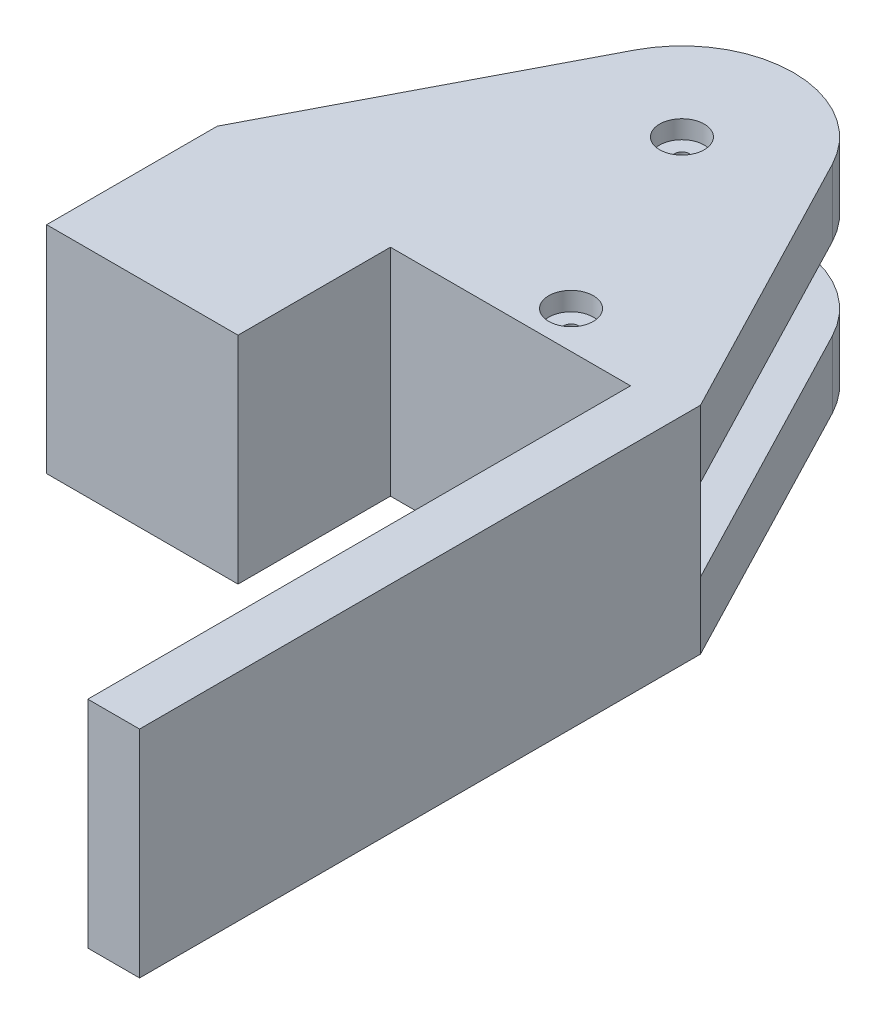
from build123d import *

# Parameters (mm, degrees)
SKETCH1_W             = 65
SKETCH1_H             = 9
BOSS_EXTRUDE1_DEPTH   = 45
BOSS_EXTRUDE1_2_DEPTH = 45
SKETCH2_R             = 1
CUT_EXTRUDE5_DEPTH    = 34
CUT_EXTRUDE6_DEPTH    = 34
SKETCH3_R             = 3
CUT_EXTRUDE7_DEPTH    = 2.45
SKETCH4_R             = 3
CUT_EXTRUDE8_DEPTH    = 2.45
SKETCH5_W             = 65
SKETCH5_H             = 29
BOSS_EXTRUDE2_DEPTH   = 2.45
SKETCH9_W             = 6.962412957
SKETCH9_H             = 29
BOSS_EXTRUDE5_DEPTH   = 73
SKETCH13_W            = 25.743716973
SKETCH13_H            = 29
BOSS_EXTRUDE6_DEPTH   = 20.5
SKETCH11_R            = 3
CUT_EXTRUDE11_DEPTH   = 2.5
SKETCH12_R            = 1
CUT_EXTRUDE12_DEPTH   = 32.5


with BuildPart() as part:
    # Sketch1 → Boss-Extrude1 (new body)
    with BuildSketch(Plane.XY):
        with Locations((32.5, 15.5)):
            Rectangle(SKETCH1_W, SKETCH1_H)
    extrude(amount=BOSS_EXTRUDE1_DEPTH)


with BuildPart() as body_2:
    # Sketch1 → Boss-Extrude1 2 (new body)
    with BuildSketch(Plane.XY):
        with Locations((32.5, 35.5)):
            Rectangle(SKETCH1_W, SKETCH1_H)
    extrude(amount=BOSS_EXTRUDE1_2_DEPTH)


with BuildPart() as cut_extrude5_tool:
    # Sketch2 → Cut-Extrude5 (new body)
    with BuildSketch(Plane.XZ.offset(-10)):
        with BuildLine():
            ThreePointArc((45.80925577, 8.081639583), (40.285389963, 2.178623197), (32.5, 0))
            Line((32.5, 0), (65, 0))
            Line((65, 0), (65, 45))
            Line((65, 45), (45.80925577, 8.081639583))
        make_face()
        with Locations((32.5, 15)):
            Circle(SKETCH2_R)
    extrude(amount=-CUT_EXTRUDE5_DEPTH)


with BuildPart() as part_1:
    add(part.part)

    # Cut-Extrude5: cut by cut_extrude5_tool
    add(cut_extrude5_tool.part, mode=Mode.SUBTRACT)


with BuildPart() as body_2_1:
    add(body_2.part)

    # Cut-Extrude5: cut by cut_extrude5_tool
    add(cut_extrude5_tool.part, mode=Mode.SUBTRACT)


with BuildPart() as cut_extrude6_tool:
    # Sketch2<6> → Cut-Extrude6 (new body)
    with BuildSketch(Plane.XZ.offset(-10)):
        with BuildLine():
            Line((19.19074423, 8.081639583), (0, 45))
            Line((0, 45), (0, 0))
            Line((0, 0), (32.5, 0))
            ThreePointArc((32.5, 0), (24.714610037, 2.178623197), (19.19074423, 8.081639583))
        make_face()
    extrude(amount=-CUT_EXTRUDE6_DEPTH)


with BuildPart() as part_2:
    add(part_1.part)

    # Cut-Extrude6: cut by cut_extrude6_tool
    add(cut_extrude6_tool.part, mode=Mode.SUBTRACT)

    # Sketch4 → Cut-Extrude8 (cut)
    with BuildSketch(Plane(origin=(0, 20, 0), x_dir=(1, 0, 0), z_dir=(0, 1, 0))):
        with Locations((32.5, -15)):
            Circle(SKETCH4_R)
    extrude(amount=-CUT_EXTRUDE8_DEPTH, mode=Mode.SUBTRACT)



with BuildPart() as body_2_2:
    add(body_2_1.part)

    # Cut-Extrude6: cut by cut_extrude6_tool
    add(cut_extrude6_tool.part, mode=Mode.SUBTRACT)

    # Sketch3 → Cut-Extrude7 (cut)
    with BuildSketch(Plane(origin=(0, 40, 0), x_dir=(1, 0, 0), z_dir=(0, 1, 0))):
        with Locations((32.5, -15)):
            Circle(SKETCH3_R)
    extrude(amount=-CUT_EXTRUDE7_DEPTH, mode=Mode.SUBTRACT)


with BuildPart() as part_3:
    add(part_2.part)

    add(body_2_2.part)  # Boss-Extrude2 merges body 2
    # Sketch5 → Boss-Extrude2 (add)
    with BuildSketch(Plane.XY.offset(45)):
        with Locations((32.5, 25.5)):
            Rectangle(SKETCH5_W, SKETCH5_H)
    extrude(amount=BOSS_EXTRUDE2_DEPTH)

    # Sketch9 → Boss-Extrude5 (add)
    with BuildSketch(Plane.XY.offset(47.45)):
        with Locations((61.518793522, 25.5)):
            Rectangle(SKETCH9_W, SKETCH9_H)
    extrude(amount=BOSS_EXTRUDE5_DEPTH)

    # Sketch13 → Boss-Extrude6 (add)
    with BuildSketch(Plane.XY.offset(47.45)):
        with Locations((12.871858487, 25.5)):
            Rectangle(SKETCH13_W, SKETCH13_H)
    extrude(amount=BOSS_EXTRUDE6_DEPTH)

    # Sketch11 → Cut-Extrude11 (cut)
    with BuildSketch(Plane(origin=(0, 40, 0), x_dir=(1, 0, 0), z_dir=(0, 1, 0))):
        with Locations((45.037587043, -42.45)):
            Circle(SKETCH11_R)
    extrude(amount=-CUT_EXTRUDE11_DEPTH, mode=Mode.SUBTRACT)

    # Sketch12 → Cut-Extrude12 (cut)
    with BuildSketch(Plane(origin=(0, 37.5, 0), x_dir=(1, 0, 0), z_dir=(0, 1, 0))):
        with Locations((45.037587043, -42.45)):
            Circle(SKETCH12_R)
    extrude(amount=-CUT_EXTRUDE12_DEPTH, mode=Mode.SUBTRACT)


solid = part_3.part
